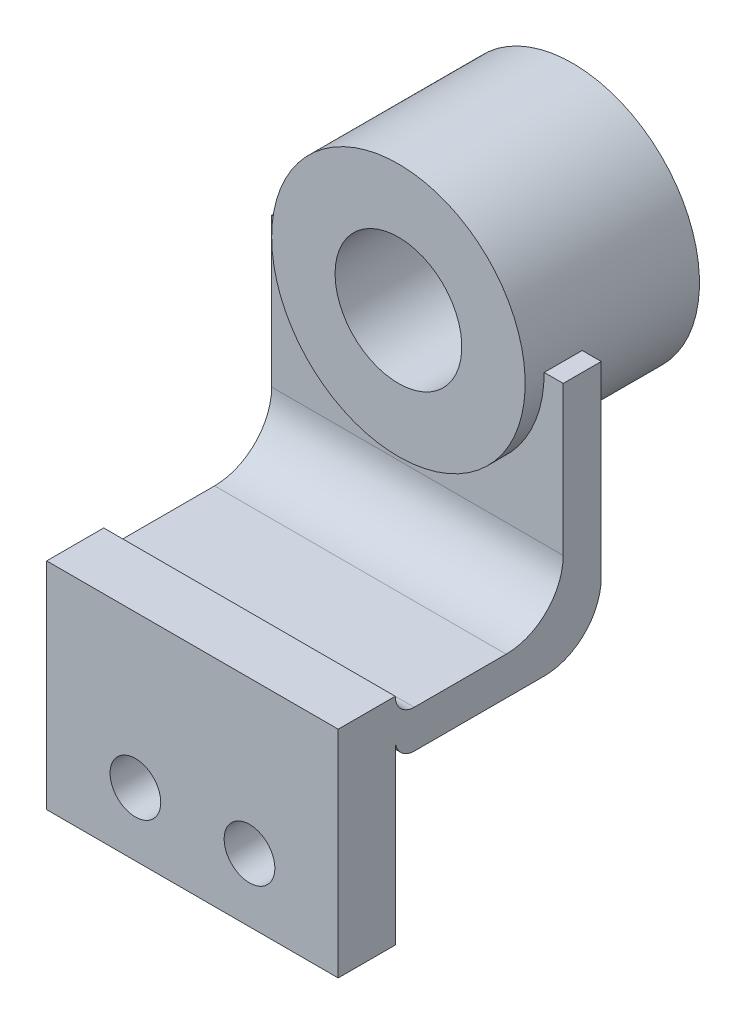
from build123d import *

# Parameters (mm, degrees)
SKETCH1_W                = 92
SKETCH1_H                = 68
BOSS_EXTRUDE1_DEPTH      = 18
SKETCH2_R                = 8
CUT_EXTRUDE4_DEPTH       = 18
BOSS_EXTRUDE3_DEPTH      = 92
FILLET2_R                = 6
BOSS_EXTRUDE4_DEPTH      = 37
BOSS_EXTRUDE4_DEPTH_BACK = 18
SKETCH9_R                = 40
SKETCH10_R               = 20
CUT_EXTRUDE6_DEPTH       = 90
RIB6_START               = -7
RIB6_DEPTH               = 14
FILLET3_R                = 6


# Read off the part's stored shape, not the designer's step: Rib6
with BuildPart() as part:
    # Sketch1 → Boss-Extrude1 (new body)
    with BuildSketch(Plane.XY):
        Rectangle(SKETCH1_W, SKETCH1_H)
    extrude(amount=BOSS_EXTRUDE1_DEPTH)

    # Sketch2 → Cut-Extrude4 (cut)
    with BuildSketch(Plane(origin=(0, 0, 0), x_dir=(-1, 0, 0), z_dir=(0, 0, -1))):
        with Locations((-18, -14)):
            Circle(SKETCH2_R)
        with Locations(Location((18, -14, 0), (0, 0, 180))):
            Circle(SKETCH2_R)
    extrude(amount=-CUT_EXTRUDE4_DEPTH, mode=Mode.SUBTRACT)

    # Sketch7 → Boss-Extrude3 (add)
    with BuildSketch(Plane.ZY.offset(46)):
        with BuildLine():
            Line((0, 28), (-35, 28))
            ThreePointArc((-35, 28), (-47.727922061, 33.272077939), (-53, 46))
            Line((-53, 46), (-53, 93))
            Line((-53, 93), (-65, 93))
            Line((-65, 93), (-65, 34))
            ThreePointArc((-65, 34), (-59.727922061, 21.272077939), (-47, 16))
            Line((-47, 16), (-6, 16))
            ThreePointArc((-6, 16), (-1.757359313, 17.757359313), (0, 22))
            Line((0, 22), (0, 28))
        make_face()
    extrude(amount=-BOSS_EXTRUDE3_DEPTH)

    # Fillet2
    fillet2_edges = [part.edges().sort_by_distance(p)[0] for p in [
        (0, 28, 0),
    ]]
    fillet(fillet2_edges, radius=FILLET2_R - 0.0001)  # a hair under: the kernel refuses the full size

    # Sketch9 → Boss-Extrude4 (add, two sides: drawn at the far end of the back side and taken through both)
    with BuildSketch(Plane(origin=(0, 0, -65), x_dir=(-1, 0, 0), z_dir=(0, 0, -1)).offset(-BOSS_EXTRUDE4_DEPTH_BACK)):
        with Locations((0, 93)):
            Circle(SKETCH9_R)
    extrude(amount=BOSS_EXTRUDE4_DEPTH + BOSS_EXTRUDE4_DEPTH_BACK)

    # Sketch10 → Cut-Extrude6 (cut)
    with BuildSketch(Plane(origin=(0, 0, -102), x_dir=(-1, 0, 0), z_dir=(0, 0, -1))):
        with Locations((0, 93)):
            Circle(SKETCH10_R)
    extrude(amount=-CUT_EXTRUDE6_DEPTH, mode=Mode.SUBTRACT)

    # Rib6 outline → Rib6 (add)
    with BuildSketch(Plane(origin=(0, 0, 0), x_dir=(0, 0, -1), z_dir=(1, 0, 0)).offset(RIB6_START)):
        with BuildLine():
            Line((89, 54), (65, 54))
            Line((65, 54), (65, 34))
            ThreePointArc((65, 34), (59.727922061, 21.272077939), (47, 16))
            Line((47, 16), (6, 16))
            ThreePointArc((6, 16), (1.757359313, 17.757359313), (0, 22))
            Line((0, 22), (0, -34))
            Line((0, -34), (66.284356879, 0.259330522))
            ThreePointArc((66.284356879, 0.259330522), (82.874384935, 15.729386584), (89, 37.570368832))
            Line((89, 37.570368832), (89, 54))
        make_face()
    extrude(amount=RIB6_DEPTH)

    # Fillet3
    fillet3_edges = [part.edges().sort_by_distance(p)[0] for p in [
        (0, 53, -89),
    ]]
    fillet(fillet3_edges, radius=FILLET3_R)


solid = part.part
